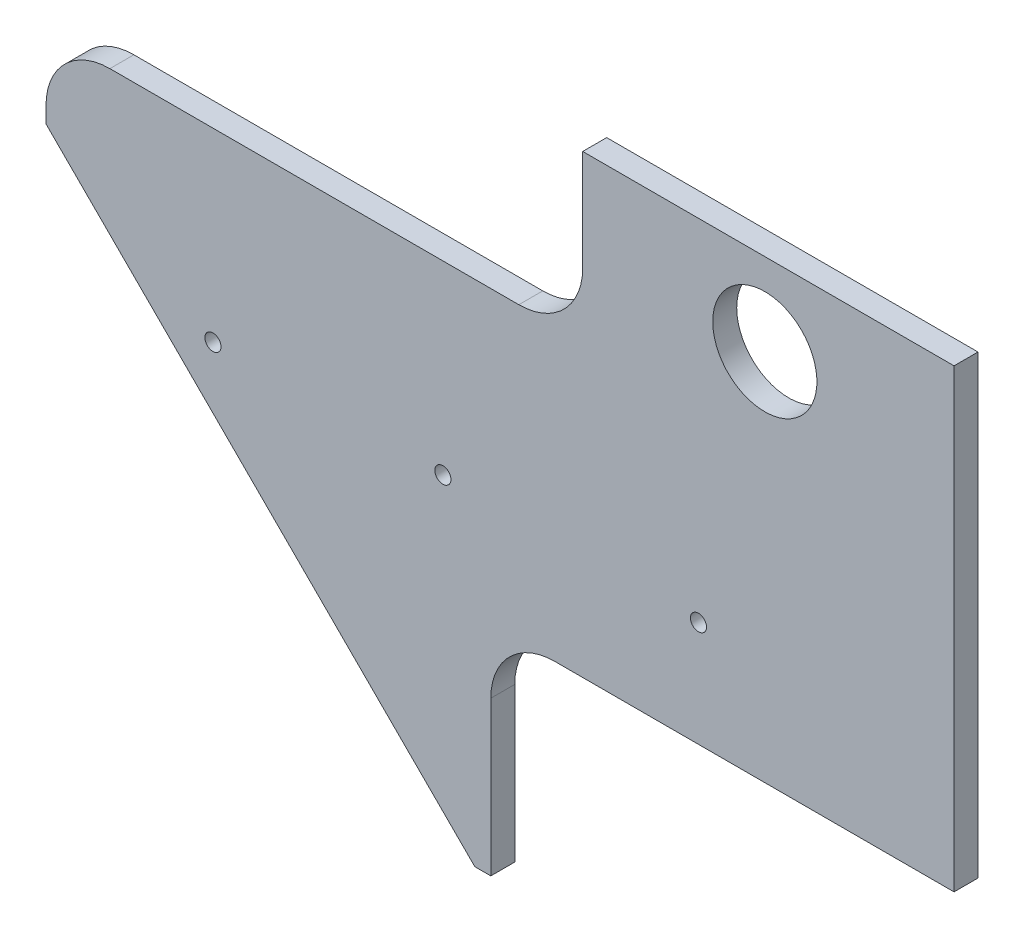
from build123d import *

# Parameters (mm, degrees)
SKETCH1_R                  = 20.701
BOSS_EXTRUDE1_DEPTH        = 9.525
SKETCH2_W                  = 184.15
SKETCH2_H                  = 86.570360006
CUT_EXTRUDE1_DEPTH         = 267.58430025
FILLET1_R                  = 25.4
SKETCH4_W                  = 213.36
SKETCH4_H                  = 65.465352004
CUT_EXTRUDE2_DEPTH         = 267.58430025
FILLET2_R                  = 25.4
F_6_4_6_4_DIAMETER_HOLE2_D = 6.4


with BuildPart() as part:
    # Sketch1 → Boss-Extrude1 (new body)
    with BuildSketch(Plane.XY):
        Polygon((-138.259383474, 48.991487021), (32.210627804, -121.478524257), (222.710627804, -121.478524257), (222.710627804, 146.206839025), (-138.259383474, 146.206839025), align=None)
        with Locations((147.490616526, 113.471475743)):
            Circle(SKETCH1_R, mode=Mode.SUBTRACT)
    extrude(amount=BOSS_EXTRUDE1_DEPTH)

    # Sketch2 → Cut-Extrude1 (cut, through all)
    with BuildSketch(Plane.XY.offset(9.525)):
        with Locations((130.635627804, -78.193344254)):
            Rectangle(SKETCH2_W, SKETCH2_H)
    extrude(amount=-CUT_EXTRUDE1_DEPTH, mode=Mode.SUBTRACT)

    # Fillet1
    fillet1_edges = [part.edges().sort_by_distance(p)[0] for p in [
        (38.560627804, -34.908164251, 4.7625),
    ]]
    fillet(fillet1_edges, radius=FILLET1_R)

    # Sketch4 → Cut-Extrude2 (cut, through all)
    with BuildSketch(Plane.XY.offset(9.525)):
        with Locations((-31.579383474, 113.474163023)):
            Rectangle(SKETCH4_W, SKETCH4_H)
    extrude(amount=-CUT_EXTRUDE2_DEPTH, mode=Mode.SUBTRACT)

    # Fillet2
    fillet2_edges = [part.edges().sort_by_distance(p)[0] for p in [
        (-138.259383474, 80.741487021, 4.7625),
        (75.100616526, 80.741487021, 4.7625),
    ]]
    fillet(fillet2_edges, radius=FILLET2_R)

    # Ø6.4 (6.4) Diameter Hole2 (through all)
    with Locations(Plane(origin=(0, 0, 0), x_dir=(-1, 0, 0), z_dir=(0, 0, -1))):
        with Locations((-121.110627804, 7.042935743), (-19.510627804, 7.042935743), (71.895728372, 7.042935743)):
            Hole(F_6_4_6_4_DIAMETER_HOLE2_D / 2)


solid = part.part
